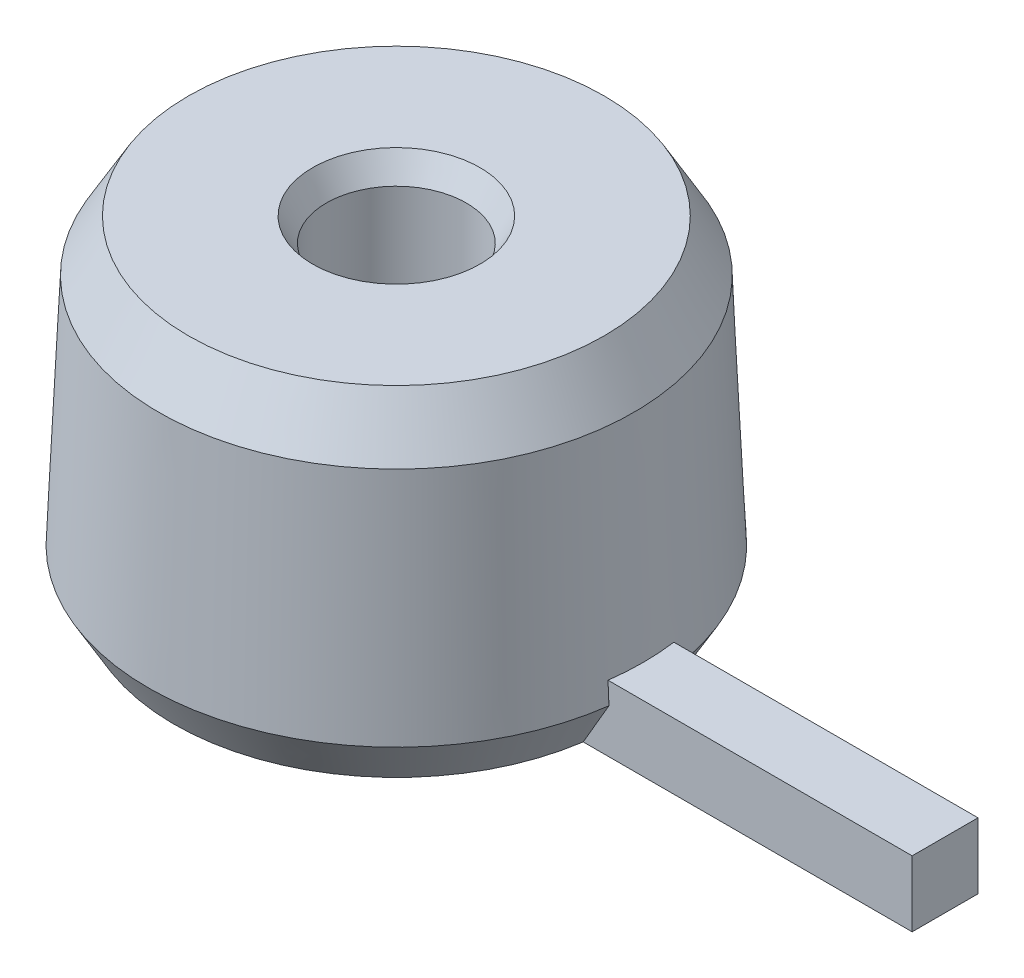
from build123d import *

# Parameters (mm, degrees)
SKETCH_1_R          = 9.1
EXTRUDE_1_DEPTH     = 12
EXTRUDE_1_TAPER     = 2.5
SKETCH_2_R          = 2.55
CUT_EXTRUDE_1_DEPTH = 8
SKETCH_3_W          = 13
SKETCH_3_H          = 2.4
EXTRUDE_2_DEPTH     = 2.4
CHAMFER_1_SIZE      = 0.5
CHAMFER_1_SIZE2     = 0.866025404
CHAMFER_2_SIZE      = 1
CHAMFER_2_SIZE2     = 1.611810972
CHAMFER_3_SIZE      = 1.87553439
CHAMFER_3_SIZE_2    = 1


with BuildPart() as part:
    # 草图1 → 凸台-拉伸1 (new body)
    with BuildSketch(Plane(origin=(0, 0, 0), x_dir=(1, 0, 0), z_dir=(0, 1, 0))):
        Circle(SKETCH_1_R)
    extrude(amount=EXTRUDE_1_DEPTH, taper=EXTRUDE_1_TAPER)

    # 草图2 → 切除-拉伸1 (cut)
    with BuildSketch(Plane(origin=(0, 12, 0), x_dir=(1, 0, 0), z_dir=(0, 1, 0))):
        with Locations(Location((0, 0, 0), (0, 0, 270))):
            Circle(SKETCH_2_R)
    extrude(amount=-CUT_EXTRUDE_1_DEPTH, mode=Mode.SUBTRACT)

    # 草图3 → 凸台-拉伸2 (add)
    with BuildSketch(Plane.XZ):
        with Locations((13.5, 0)):
            Rectangle(SKETCH_3_W, SKETCH_3_H)
    extrude(amount=-EXTRUDE_2_DEPTH)

    # 倒角1
    chamfer_1_edges = [part.edges().sort_by_distance(p)[0] for p in [
        (0, 12, -2.55),
    ]]
    chamfer_1_side = [part.faces().sort_by_distance(p)[0] for p in [
        (-8.333500832, 12, 0),
    ]]
    chamfer(chamfer_1_edges, length=CHAMFER_1_SIZE, length2=CHAMFER_1_SIZE2, reference=chamfer_1_side[0])

    # 倒角2
    chamfer_2_edges = [part.edges().sort_by_distance(p)[0] for p in [
        (-9.1, 0, 0),
    ]]
    chamfer_2_side = [part.faces().sort_by_distance(p)[0] for p in [
        (1.331118316, 0, 0),
    ]]
    chamfer(chamfer_2_edges, length=CHAMFER_2_SIZE, length2=CHAMFER_2_SIZE2, reference=chamfer_2_side[0])

    # 倒角3
    # the kernel refuses this chamfer: 1.87553439, 1 mm, written as the material it takes off along each edge
    with BuildSketch(Plane(origin=(0, 12, 0), x_dir=(1, 0, 0), z_dir=(0, 0, -1))) as chamfer_3_piece_1:
        Polygon((8.576068685 + CHAMFER_3_SIZE * 0.0436193873717, CHAMFER_3_SIZE * 0.999048221729), (8.576068685 - CHAMFER_3_SIZE_2, 0), (8.576068685, 0), align=None)
    revolve(axis=Axis((0, 12, 0), (0, -1, 0)), mode=Mode.SUBTRACT)


solid = part.part
